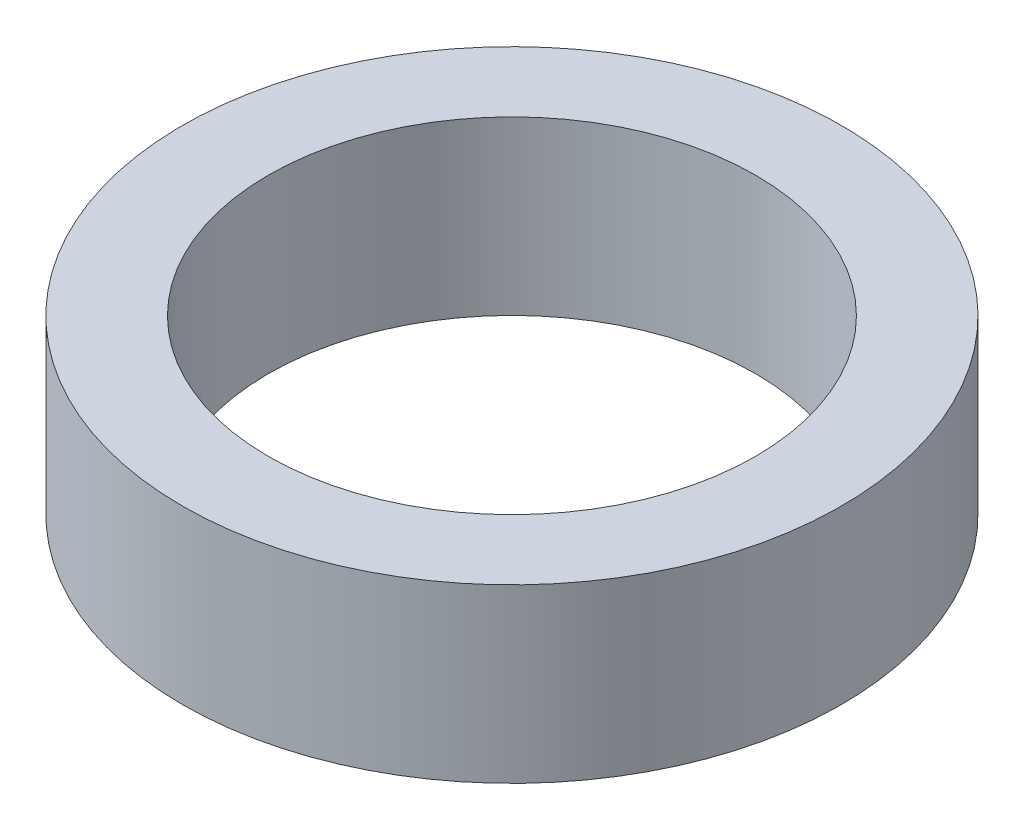
from build123d import *

# Parameters (mm, degrees)
SKETCH1_R           = 57.5
BOSS_EXTRUDE1_DEPTH = 30
SKETCH2_R           = 42.5
CUT_EXTRUDE1_DEPTH  = 87.674679117


with BuildPart() as part:
    # Sketch1 → Boss-Extrude1 (new body)
    with BuildSketch(Plane(origin=(0, 0, 0), x_dir=(1, 0, 0), z_dir=(0, 1, 0))):
        Circle(SKETCH1_R)
    extrude(amount=BOSS_EXTRUDE1_DEPTH)

    # Sketch2 → Cut-Extrude1 (cut, through all)
    with BuildSketch(Plane(origin=(0, 0, 0), x_dir=(1, 0, 0), z_dir=(0, 1, 0))):
        Circle(SKETCH2_R)
    extrude(amount=CUT_EXTRUDE1_DEPTH, mode=Mode.SUBTRACT)


solid = part.part
